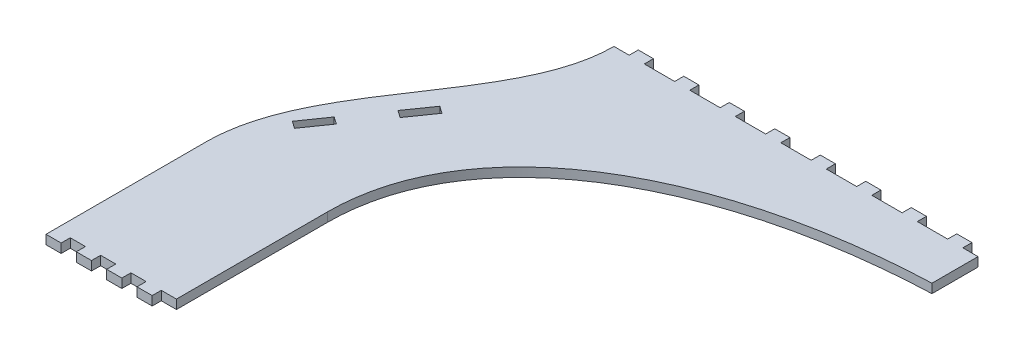
from build123d import *

# Parameters (mm, degrees)
BOSS_EXTRUDE1_DEPTH = 6
SKETCH2_W           = 10
SKETCH2_H           = 6
BOSS_EXTRUDE2_DEPTH = 6
SKETCH3_W           = 10
SKETCH3_H           = 6
BOSS_EXTRUDE3_DEPTH = 6
SKETCH4_W           = 20
SKETCH4_H           = 30.367424907
CUT_EXTRUDE1_DEPTH  = 6
CUT_EXTRUDE2_DEPTH  = 355.990492973
FLEX1_DEPTH         = 6
FLEX1_2_DEPTH       = 6


# Read off the part's stored shape, not the designer's step: Flex1
with BuildPart() as part:
    # Sketch1 → Boss-Extrude1 (new body)
    with BuildSketch(Plane(origin=(0, 0, 0), x_dir=(1, 0, 0), z_dir=(0, 1, 0))):
        with BuildLine():
            Line((0, 0), (0, 66.5))
            add(Edge.make_bspline(
                [(0, 66.5), (0, 168.087947667), (114.415275211, 225.5), (260, 225.5)],
                knots=[0, 0, 0, 0, 1, 1, 1, 1], degree=3))
            Line((260, 225.5), (260, 255.5))
            Line((260, 255.5), (0, 255.5))
            add(Edge.make_bspline(
                [(-80, 66.5), (-80, 138.367791909), (0, 189.401588521), (0, 255.5)],
                knots=[0, 0, 0, 0, 1, 1, 1, 1], degree=3))
            Line((-80, 66.5), (-80, 0))
            Line((-80, 0), (0, 0))
        make_face()
    extrude(amount=BOSS_EXTRUDE1_DEPTH)

    # Sketch2 → Boss-Extrude2 (add)
    with BuildSketch(Plane(origin=(0, 6, 0), x_dir=(1, 0, 0), z_dir=(0, 1, 0))):
        with Locations((-35, -3)):
            Rectangle(SKETCH2_W, SKETCH2_H)
        with Locations((-15, -3)):
            Rectangle(SKETCH2_W, SKETCH2_H)
        with Locations((-55, -3)):
            Rectangle(SKETCH2_W, SKETCH2_H)
        with Locations((-75, -3)):
            Rectangle(SKETCH2_W, SKETCH2_H)
    extrude(amount=-BOSS_EXTRUDE2_DEPTH)

    # Sketch3 → Boss-Extrude3 (add)
    with BuildSketch(Plane(origin=(0, 6, 0), x_dir=(1, 0, 0), z_dir=(0, 1, 0))):
        with Locations((195, 258.5)):
            Rectangle(SKETCH3_W, SKETCH3_H)
        with Locations((225, 258.5)):
            Rectangle(SKETCH3_W, SKETCH3_H)
        with Locations((165, 258.5)):
            Rectangle(SKETCH3_W, SKETCH3_H)
        with Locations((135, 258.5)):
            Rectangle(SKETCH3_W, SKETCH3_H)
        with Locations((105, 258.5)):
            Rectangle(SKETCH3_W, SKETCH3_H)
        with Locations((75, 258.5)):
            Rectangle(SKETCH3_W, SKETCH3_H)
        with Locations((45, 258.5)):
            Rectangle(SKETCH3_W, SKETCH3_H)
        with Locations((15, 258.5)):
            Rectangle(SKETCH3_W, SKETCH3_H)
    extrude(amount=-BOSS_EXTRUDE3_DEPTH)

    # Sketch4 → Cut-Extrude1 (cut)
    with BuildSketch(Plane(origin=(0, 6, 0), x_dir=(1, 0, 0), z_dir=(0, 1, 0))):
        with Locations((250, 240.316287547)):
            Rectangle(SKETCH4_W, SKETCH4_H)
    extrude(amount=-CUT_EXTRUDE1_DEPTH, mode=Mode.SUBTRACT)

    # Sketch5 → Cut-Extrude2 (cut, through all)
    with BuildSketch(Plane(origin=(0, 6, 0), x_dir=(1, 0, 0), z_dir=(0, 1, 0))):
        Polygon((-29.891687561, 144.39007032), (-34.642769417, 147.71681365), (-23.285955978, 163.936024127), (-18.534874121, 160.609280796), align=None)
        Polygon((-58.550195169, 103.425626242), (-63.308179345, 106.742490211), (-51.985092004, 122.985263776), (-47.227107828, 119.668399807), align=None)
    extrude(amount=-CUT_EXTRUDE2_DEPTH, mode=Mode.SUBTRACT)

    # Flex1 outline → Flex1 (cut)
    with BuildSketch(Plane(origin=(0, 0, 0), x_dir=(1, 0, 0), z_dir=(0, 1, 0))):
        with BuildLine():
            add(Edge.make_bspline(
                [(0, 90.229900389), (0, 187.117415556), (104.072328665, 243.822461296), (240.00000001, 248.862475483)],
                knots=[0, 0, 0, 0, 0.953730412, 0.953730412, 0.953730412, 0.953730412], degree=3))
            Line((0, 90.229900389), (0, 66.5))
            add(Edge.make_bspline(
                [(0, 66.5), (0, 163.387515167), (104.072328665, 220.092560907), (240.00000001, 225.132575093)],
                knots=[0, 0, 0, 0, 0.953730412, 0.953730412, 0.953730412, 0.953730412], degree=3))
            Line((240.00000001, 225.132575093), (240.00000001, 248.862475483))
        make_face()
        with BuildLine():
            add(Edge.make_bspline(
                [(-51.148803226, 146.132174392), (-54.710438553, 140.513781755), (-58.143911828, 134.842056067), (-61.323392575, 129.088765208)],
                knots=[0.594014657, 0.594014657, 0.594014657, 0.594014657, 0.686318961, 0.686318961, 0.686318961, 0.686318961], degree=3))
            Line((-61.323392575, 129.088765208), (-58.550195169, 127.155526632))
            Line((-58.550195169, 127.155526632), (-47.227107828, 143.398300196))
            Line((-47.227107828, 143.398300196), (-51.148803226, 146.132174392))
        make_face()
        with BuildLine():
            add(Edge.make_bspline(
                [(-31.878447999, 175.394574164), (-32.758957733, 174.05373382), (-33.644948776, 172.71267215), (-34.534615872, 171.370984112)],
                knots=[0.431899292, 0.431899292, 0.431899292, 0.431899292, 0.454328108, 0.454328108, 0.454328108, 0.454328108], degree=3))
            Line((-34.534615872, 171.370984112), (-29.891687561, 168.119970709))
            Line((-29.891687561, 168.119970709), (-18.534874121, 184.339181186))
            Line((-18.534874121, 184.339181186), (-23.285955978, 187.665924517))
            Line((-23.285955978, 187.665924517), (-31.878447999, 175.394574164))
        make_face()
    extrude(amount=FLEX1_DEPTH, mode=Mode.SUBTRACT)

    # Flex1 2 outline → Flex1 2 (add)
    with BuildSketch(Plane(origin=(0, 0, 0), x_dir=(1, 0, 0), z_dir=(0, 1, 0))):
        with BuildLine():
            Line((230, 255.5), (240, 255.5))
            Line((240, 255.5), (240, 279.229900389))
            Line((240, 279.229900389), (230, 279.229900389))
            Line((230, 279.229900389), (230, 285.229900389))
            Line((230, 285.229900389), (220, 285.229900389))
            Line((220, 285.229900389), (220, 279.229900389))
            Line((220, 279.229900389), (200, 279.229900389))
            Line((200, 279.229900389), (200, 285.229900389))
            Line((200, 285.229900389), (190, 285.229900389))
            Line((190, 285.229900389), (190, 279.229900389))
            Line((190, 279.229900389), (170, 279.229900389))
            Line((170, 279.229900389), (170, 285.229900389))
            Line((170, 285.229900389), (160, 285.229900389))
            Line((160, 285.229900389), (160, 279.229900389))
            Line((160, 279.229900389), (140, 279.229900389))
            Line((140, 279.229900389), (140, 285.229900389))
            Line((140, 285.229900389), (130, 285.229900389))
            Line((130, 285.229900389), (130, 279.229900389))
            Line((130, 279.229900389), (110, 279.229900389))
            Line((110, 279.229900389), (110, 285.229900389))
            Line((110, 285.229900389), (100, 285.229900389))
            Line((100, 285.229900389), (100, 279.229900389))
            Line((100, 279.229900389), (80, 279.229900389))
            Line((80, 279.229900389), (80, 285.229900389))
            Line((80, 285.229900389), (70, 285.229900389))
            Line((70, 285.229900389), (70, 279.229900389))
            Line((70, 279.229900389), (50, 279.229900389))
            Line((50, 279.229900389), (50, 285.229900389))
            Line((50, 285.229900389), (40, 285.229900389))
            Line((40, 285.229900389), (40, 279.229900389))
            Line((40, 279.229900389), (20, 279.229900389))
            Line((20, 279.229900389), (20, 285.229900389))
            Line((20, 285.229900389), (10, 285.229900389))
            Line((10, 285.229900389), (10, 279.229900389))
            Line((10, 279.229900389), (0, 279.229900389))
            add(Edge.make_bspline(
                [(0, 279.229900389), (0, 213.131488911), (-80, 162.097692299), (-80, 90.229900389)],
                knots=[0, 0, 0, 0, 1, 1, 1, 1], degree=3))
            Line((-80, 90.229900389), (-80, 66.5))
            add(Edge.make_bspline(
                [(-61.323392575, 129.088765208), (-72.12833646, 109.537149765), (-80, 89.04356364), (-80, 66.5)],
                knots=[0.686318961, 0.686318961, 0.686318961, 0.686318961, 1, 1, 1, 1], degree=3))
            Line((-61.323392575, 129.088765208), (-63.308179345, 130.4723906))
            Line((-63.308179345, 130.4723906), (-51.985092004, 146.715164165))
            Line((-51.985092004, 146.715164165), (-51.148803226, 146.132174392))
            add(Edge.make_bspline(
                [(-34.534615872, 171.370984112), (-40.075457788, 163.01495819), (-45.758886122, 154.634636824), (-51.148803226, 146.132174392)],
                knots=[0.454328108, 0.454328108, 0.454328108, 0.454328108, 0.594014657, 0.594014657, 0.594014657, 0.594014657], degree=3))
            Line((-34.534615872, 171.370984112), (-34.642769417, 171.44671404))
            Line((-34.642769417, 171.44671404), (-31.878447999, 175.394574164))
            add(Edge.make_bspline(
                [(0, 255.5), (0, 226.952142889), (-14.922959865, 201.214393816), (-31.878447999, 175.394574164)],
                knots=[0, 0, 0, 0, 0.431899292, 0.431899292, 0.431899292, 0.431899292], degree=3))
            Line((0, 255.5), (10, 255.5))
            Line((10, 255.5), (10, 261.5))
            Line((10, 261.5), (20, 261.5))
            Line((20, 261.5), (20, 255.5))
            Line((20, 255.5), (40, 255.5))
            Line((40, 255.5), (40, 261.5))
            Line((40, 261.5), (50, 261.5))
            Line((50, 261.5), (50, 255.5))
            Line((50, 255.5), (70, 255.5))
            Line((70, 255.5), (70, 261.5))
            Line((70, 261.5), (80, 261.5))
            Line((80, 261.5), (80, 255.5))
            Line((80, 255.5), (100, 255.5))
            Line((100, 255.5), (100, 261.5))
            Line((100, 261.5), (110, 261.5))
            Line((110, 261.5), (110, 255.5))
            Line((110, 255.5), (130, 255.5))
            Line((130, 255.5), (130, 261.5))
            Line((130, 261.5), (140, 261.5))
            Line((140, 261.5), (140, 255.5))
            Line((140, 255.5), (160, 255.5))
            Line((160, 255.5), (160, 261.5))
            Line((160, 261.5), (170, 261.5))
            Line((170, 261.5), (170, 255.5))
            Line((170, 255.5), (190, 255.5))
            Line((190, 255.5), (190, 261.5))
            Line((190, 261.5), (200, 261.5))
            Line((200, 261.5), (200, 255.5))
            Line((200, 255.5), (220, 255.5))
            Line((220, 255.5), (220, 261.5))
            Line((220, 261.5), (230, 261.5))
            Line((230, 261.5), (230, 255.5))
        make_face()
        Polygon((0, -9.270099611), (0, 0), (-10, 0), (-10, -6), (-20, -6), (-20, 0), (-30, 0), (-30, -6), (-40, -6), (-40, 0), (-50, 0), (-50, -6), (-60, -6), (-60, 0), (-70, 0), (-70, -6), (-80, -6), (-80, -15.270099611), (-70, -15.270099611), (-70, -9.270099611), (-60, -9.270099611), (-60, -15.270099611), (-50, -15.270099611), (-50, -9.270099611), (-40, -9.270099611), (-40, -15.270099611), (-30, -15.270099611), (-30, -9.270099611), (-20, -9.270099611), (-20, -15.270099611), (-10, -15.270099611), (-10, -9.270099611), align=None)
        Polygon((-63.308179345, 106.742490211), (-58.550195169, 103.425626242), (-47.227107828, 119.668399807), (-51.985092004, 122.985263776), align=None)
        Polygon((-34.642769417, 147.71681365), (-29.891687561, 144.39007032), (-18.534874121, 160.609280796), (-23.285955978, 163.936024127), align=None)
    extrude(amount=FLEX1_2_DEPTH)


solid = part.part
